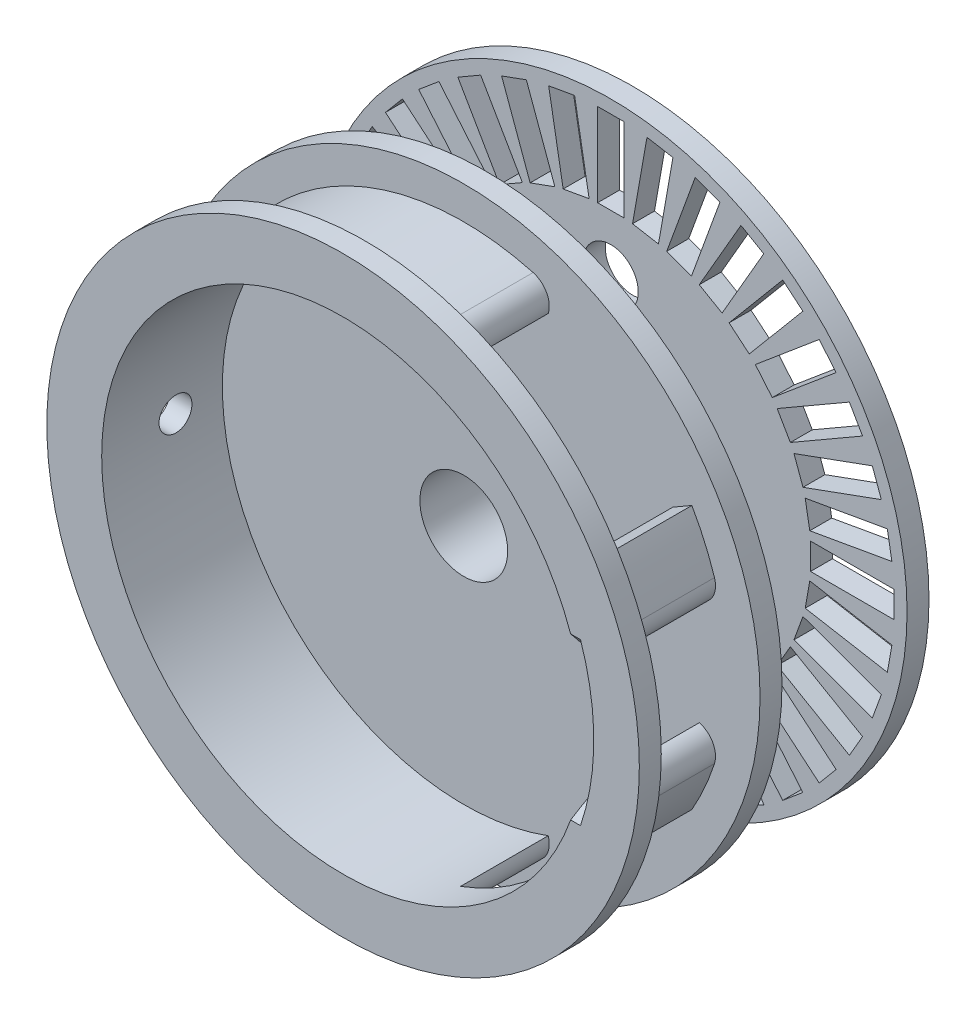
from build123d import *

# Parameters (mm, degrees)
SKETCH1_R           = 13.5
SKETCH1_R_2         = 2
SKETCH1_W           = 1.2
SKETCH1_H           = 3.8
SKETCH1_W_2         = 3.8
SKETCH1_H_2         = 1.2
BOSS_EXTRUDE1_DEPTH = 1
SKETCH2_R           = 5
SKETCH2_R_2         = 2
BOSS_EXTRUDE2_DEPTH = 5.7
SKETCH3_R           = 12
SKETCH3_R_2         = 2
BOSS_EXTRUDE3_DEPTH = 1
BOSS_EXTRUDE4_DEPTH = 5.5
CUT_EXTRUDE1_DEPTH  = 4
FILLET1_R           = 1
FILLET2_R           = 1
SKETCH7_R           = 1.25
CUT_EXTRUDE3_DEPTH  = 4
CUT_EXTRUDE4_START  = 10.369405374
CUT_EXTRUDE4_DEPTH  = 1.103268378
SKETCH10_W          = 2.075264998
SKETCH10_H          = 1
SKETCH11_R          = 0.75
CUT_EXTRUDE6_DEPTH  = 100


# Read off the part's stored shape, not the designer's step: Cut-Extrude4
with BuildPart() as part:
    # Sketch1 → Boss-Extrude1 (new body)
    with BuildSketch(Plane.XY):
        Circle(SKETCH1_R)
        Circle(SKETCH1_R_2, mode=Mode.SUBTRACT)
        Polygon((2.171083069, 8.857561646), (0.989313765, 9.065939459), (1.64917684, 12.80820892), (2.830946144, 12.599831107), align=None, mode=Mode.SUBTRACT)
        with Locations((0, 11)):
            Rectangle(SKETCH1_W, SKETCH1_H, mode=Mode.SUBTRACT)
        Polygon((3.676198877, 8.345990763), (2.548567732, 8.756414935), (3.848244276, 12.327246894), (4.975875421, 11.916822722), align=None, mode=Mode.SUBTRACT)
        Polygon((5.069615242, 7.580831174), (4.030384758, 8.180831174), (5.930384758, 11.471727709), (6.969615242, 10.871727709), align=None, mode=Mode.SUBTRACT)
        Polygon((6.308993914, 6.585331867), (5.389740582, 7.356676998), (7.832333499, 10.267645882), (8.751586831, 9.49630075), align=None, mode=Mode.SUBTRACT)
        Polygon((7.356676998, 5.389740582), (6.585331867, 6.308993914), (9.49630075, 8.751586831), (10.267645882, 7.832333499), align=None, mode=Mode.SUBTRACT)
        Polygon((8.180831174, 4.030384758), (7.580831174, 5.069615242), (10.871727709, 6.969615242), (11.471727709, 5.930384758), align=None, mode=Mode.SUBTRACT)
        Polygon((8.756414935, 2.548567732), (8.345990763, 3.676198877), (11.916822722, 4.975875421), (12.327246894, 3.848244276), align=None, mode=Mode.SUBTRACT)
        Polygon((9.065939459, 0.989313765), (8.857561646, 2.171083069), (12.599831107, 2.830946144), (12.80820892, 1.64917684), align=None, mode=Mode.SUBTRACT)
        with Locations((11, 0)):
            Rectangle(SKETCH1_W_2, SKETCH1_H_2, mode=Mode.SUBTRACT)
        Polygon((8.857561646, -2.171083069), (9.065939459, -0.989313765), (12.80820892, -1.64917684), (12.599831107, -2.830946144), align=None, mode=Mode.SUBTRACT)
        Polygon((8.345990763, -3.676198877), (8.756414935, -2.548567732), (12.327246894, -3.848244276), (11.916822722, -4.975875421), align=None, mode=Mode.SUBTRACT)
        Polygon((7.580831174, -5.069615242), (8.180831174, -4.030384758), (11.471727709, -5.930384758), (10.871727709, -6.969615242), align=None, mode=Mode.SUBTRACT)
        Polygon((6.585331867, -6.308993914), (7.356676998, -5.389740582), (10.267645882, -7.832333499), (9.49630075, -8.751586831), align=None, mode=Mode.SUBTRACT)
        Polygon((5.389740582, -7.356676998), (6.308993914, -6.585331867), (8.751586831, -9.49630075), (7.832333499, -10.267645882), align=None, mode=Mode.SUBTRACT)
        Polygon((4.030384758, -8.180831174), (5.069615242, -7.580831174), (6.969615242, -10.871727709), (5.930384758, -11.471727709), align=None, mode=Mode.SUBTRACT)
        Polygon((2.548567732, -8.756414935), (3.676198877, -8.345990763), (4.975875421, -11.916822722), (3.848244276, -12.327246894), align=None, mode=Mode.SUBTRACT)
        Polygon((0.989313765, -9.065939459), (2.171083069, -8.857561646), (2.830946144, -12.599831107), (1.64917684, -12.80820892), align=None, mode=Mode.SUBTRACT)
        with Locations((0, -11)):
            Rectangle(SKETCH1_W, SKETCH1_H, mode=Mode.SUBTRACT)
        Polygon((-2.171083069, -8.857561646), (-0.989313765, -9.065939459), (-1.64917684, -12.80820892), (-2.830946144, -12.599831107), align=None, mode=Mode.SUBTRACT)
        Polygon((-3.676198877, -8.345990763), (-2.548567732, -8.756414935), (-3.848244276, -12.327246894), (-4.975875421, -11.916822722), align=None, mode=Mode.SUBTRACT)
        Polygon((-5.069615242, -7.580831174), (-4.030384758, -8.180831174), (-5.930384758, -11.471727709), (-6.969615242, -10.871727709), align=None, mode=Mode.SUBTRACT)
        Polygon((-6.308993914, -6.585331867), (-5.389740582, -7.356676998), (-7.832333499, -10.267645882), (-8.751586831, -9.49630075), align=None, mode=Mode.SUBTRACT)
        Polygon((-7.356676998, -5.389740582), (-6.585331867, -6.308993914), (-9.49630075, -8.751586831), (-10.267645882, -7.832333499), align=None, mode=Mode.SUBTRACT)
        Polygon((-8.180831174, -4.030384758), (-7.580831174, -5.069615242), (-10.871727709, -6.969615242), (-11.471727709, -5.930384758), align=None, mode=Mode.SUBTRACT)
        Polygon((-8.756414935, -2.548567732), (-8.345990763, -3.676198877), (-11.916822722, -4.975875421), (-12.327246894, -3.848244276), align=None, mode=Mode.SUBTRACT)
        Polygon((-9.065939459, -0.989313765), (-8.857561646, -2.171083069), (-12.599831107, -2.830946144), (-12.80820892, -1.64917684), align=None, mode=Mode.SUBTRACT)
        with Locations((-11, 0)):
            Rectangle(SKETCH1_W_2, SKETCH1_H_2, mode=Mode.SUBTRACT)
        Polygon((-8.857561646, 2.171083069), (-9.065939459, 0.989313765), (-12.80820892, 1.64917684), (-12.599831107, 2.830946144), align=None, mode=Mode.SUBTRACT)
        Polygon((-8.345990763, 3.676198877), (-8.756414935, 2.548567732), (-12.327246894, 3.848244276), (-11.916822722, 4.975875421), align=None, mode=Mode.SUBTRACT)
        Polygon((-7.580831174, 5.069615242), (-8.180831174, 4.030384758), (-11.471727709, 5.930384758), (-10.871727709, 6.969615242), align=None, mode=Mode.SUBTRACT)
        Polygon((-6.585331867, 6.308993914), (-7.356676998, 5.389740582), (-10.267645882, 7.832333499), (-9.49630075, 8.751586831), align=None, mode=Mode.SUBTRACT)
        Polygon((-5.389740582, 7.356676998), (-6.308993914, 6.585331867), (-8.751586831, 9.49630075), (-7.832333499, 10.267645882), align=None, mode=Mode.SUBTRACT)
        Polygon((-4.030384758, 8.180831174), (-5.069615242, 7.580831174), (-6.969615242, 10.871727709), (-5.930384758, 11.471727709), align=None, mode=Mode.SUBTRACT)
        Polygon((-2.548567732, 8.756414935), (-3.676198877, 8.345990763), (-4.975875421, 11.916822722), (-3.848244276, 12.327246894), align=None, mode=Mode.SUBTRACT)
        Polygon((-0.989313765, 9.065939459), (-2.171083069, 8.857561646), (-2.830946144, 12.599831107), (-1.64917684, 12.80820892), align=None, mode=Mode.SUBTRACT)
    extrude(amount=BOSS_EXTRUDE1_DEPTH)

    # Sketch2 → Boss-Extrude2 (add)
    with BuildSketch(Plane.XY.offset(1)):
        Circle(SKETCH2_R)
        Circle(SKETCH2_R_2, mode=Mode.SUBTRACT)
    extrude(amount=BOSS_EXTRUDE2_DEPTH)

    # Sketch3 → Boss-Extrude3 (add)
    with BuildSketch(Plane.XY.offset(6.7)):
        Circle(SKETCH3_R)
        Circle(SKETCH3_R_2, mode=Mode.SUBTRACT)
    extrude(amount=BOSS_EXTRUDE3_DEPTH)

    # Sketch4 → Boss-Extrude4 (add)
    with BuildSketch(Plane.XY.offset(7.7)):
        with BuildLine():
            Line((11.757550765, -2.4), (10.73498952, -2.4))
            ThreePointArc((10.73498952, -2.4), (-11, 0), (10.73498952, 2.4))
            Line((10.73498952, 2.4), (11.757550765, 2.4))
            ThreePointArc((11.757550765, 2.4), (-12, 0), (11.757550765, -2.4))
        make_face()
    extrude(amount=BOSS_EXTRUDE4_DEPTH)

    # Sketch5 → Cut-Extrude1 (cut)
    with BuildSketch(Plane.XY.offset(7.7)):
        with BuildLine():
            ThreePointArc((3.848469228, 10.304818514), (7.105810702, 8.396871695), (9.526279442, 5.5))
            Line((9.526279442, 5.5), (11.691342951, 6.75))
            ThreePointArc((11.691342951, 6.75), (9.442683012, 9.648095022), (6.496874512, 11.833876017))
            Line((6.496874512, 11.833876017), (3.848469228, 10.304818514))
        make_face()
        with BuildLine():
            Line((11.691342951, -6.75), (9.526279442, -5.5))
            ThreePointArc((9.526279442, -5.5), (7.105810702, -8.396871695), (3.848469228, -10.304818514))
            Line((3.848469228, -10.304818514), (6.496874512, -11.833876017))
            ThreePointArc((6.496874512, -11.833876017), (9.442683012, -9.648095022), (11.691342951, -6.75))
        make_face()
    extrude(amount=CUT_EXTRUDE1_DEPTH, mode=Mode.SUBTRACT)

    # Fillet1
    # the kernel refuses this fillet: 1 mm, written as the material it takes off along each edge
    with BuildSketch(Plane(origin=(11.757550765, 2.4, 7.7), x_dir=(-0.2533335605800775, 0.9673789883410845, 0), z_dir=(0, 0, 1))) as fillet1_piece_1:
        with BuildLine():
            CenterArc((1.259005869, 0.998500676), FILLET1_R, 180.532652904, 92.605251265)
            Line((0.259049081, 0.989204263), (0, 0))
            ThreePointArc((0, 0), (0.656872627, -0.01799189), (1.313745254, 0))
        make_face()
    extrude(amount=8.784363135, mode=Mode.SUBTRACT)
    with BuildSketch(Plane(origin=(11.757550765, -2.4, 7.7), x_dir=(-0.25333356058007866, -0.9673789883410842, 0), z_dir=(0, 0, 1))) as fillet1_piece_2:
        with BuildLine():
            CenterArc((1.259005869, -0.998500676), FILLET1_R, 86.862095831, 92.605251265)
            Line((0.259049081, -0.989204263), (0, 0))
            ThreePointArc((0, 0), (0.656872627, 0.01799189), (1.313745254, 0))
        make_face()
    extrude(amount=8.784363135, mode=Mode.SUBTRACT)

    # Fillet2
    # the kernel refuses this fillet: 1 mm, written as the material it takes off along each edge
    with BuildSketch(Plane(origin=(4.940971508, 10.935574999, 11.7), x_dir=(-0.9409311106687214, 0.33859805813933214, 0), z_dir=(0, 0, -1))) as fillet2_piece_1:
        with BuildLine():
            CenterArc((1.813836253, -0.996885507), FILLET2_R, 85.476817912, 92.605251265)
            Line((0.814396462, -0.963417551), (0, 0))
            ThreePointArc((0, 0), (0.94634935, 0.037373913), (1.892698699, 0))
        make_face()
    extrude(amount=4, mode=Mode.SUBTRACT)
    with BuildSketch(Plane(origin=(4.940971508, -10.935574999, 11.7), x_dir=(-0.9409311106687219, -0.33859805813933025, 0), z_dir=(0, 0, -1))) as fillet2_piece_2:
        with BuildLine():
            CenterArc((1.813836253, 0.996885507), FILLET2_R, 181.917930823, 92.605251265)
            Line((0.814396462, 0.963417551), (0, 0))
            ThreePointArc((0, 0), (0.94634935, -0.037373913), (1.892698699, 0))
        make_face()
    extrude(amount=4, mode=Mode.SUBTRACT)

    # Sketch7 → Cut-Extrude3 (cut)
    with BuildSketch(Plane(origin=(0, 0, 0), x_dir=(-1, 0, 0), z_dir=(0, 0, -1))):
        with Locations((0, 6.5)):
            Circle(SKETCH7_R)
    extrude(amount=-CUT_EXTRUDE3_DEPTH, mode=Mode.SUBTRACT)

    # Cut-Extrude4 outline → Cut-Extrude4 (cut)
    with BuildSketch(Plane(origin=(0, 0, 0), x_dir=(0, 0, -1), z_dir=(1, 0, 0)).offset(CUT_EXTRUDE4_START)):
        with BuildLine():
            Line((-10.819261412, -1.947592153), (-10.819261412, 1.947592153))
            ThreePointArc((-10.819261412, 1.947592153), (-11.36078206, 2.137803939), (-11.871348766, 2.4))
            ThreePointArc((-11.871348766, 2.4), (-12.606000563, 2.961922287), (-13.2, 3.670889555))
            Line((-13.2, 3.670889555), (-13.2, -3.670889555))
            ThreePointArc((-13.2, -3.670889555), (-12.606000563, -2.961922287), (-11.871348766, -2.4))
            ThreePointArc((-11.871348766, -2.4), (-11.36078206, -2.137803939), (-10.819261412, -1.947592153))
        make_face()
    extrude(amount=CUT_EXTRUDE4_DEPTH, mode=Mode.SUBTRACT)

    # Sketch10 → Revolve1 (revolve)
    with BuildSketch(Plane(origin=(0, 0, 0), x_dir=(1, 0, 0), z_dir=(0, 1, 0))):
        with Locations((12.462367501, -7.2)):
            Rectangle(SKETCH10_W, SKETCH10_H)
        with Locations((12.462367501, -12.7)):
            Rectangle(SKETCH10_W, SKETCH10_H)
    revolve(axis=Axis((0, 0, 0), (0, 0, -1)))

    # Sketch11 → Cut-Extrude6 (cut)
    with BuildSketch(Plane(origin=(0, 0, 0), x_dir=(0, 0, -1), z_dir=(1, 0, 0))):
        with Locations((-9.837125613, 0)):
            Circle(SKETCH11_R)
    extrude(amount=-CUT_EXTRUDE6_DEPTH, mode=Mode.SUBTRACT)


solid = part.part
